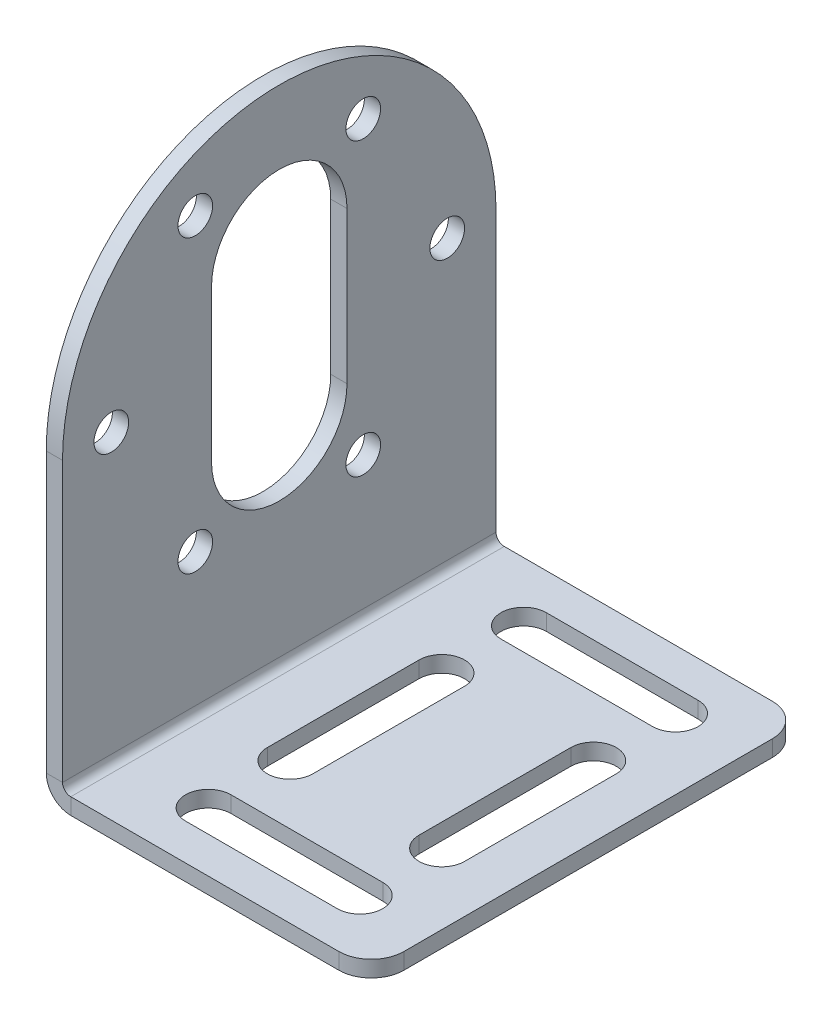
from build123d import *

# Parameters (mm, degrees)
BOSS_EXTRUDE1_DEPTH    = 1.5
SKETCH2_W              = 30
SKETCH2_H              = 40
BOSS_EXTRUDE2_DEPTH    = 1.5
CONVERT_SOLID1_START   = -20
CONVERT_SOLID1_DEPTH   = 40
CONVERT_SOLID1_2_DEPTH = 40
M3_CLEARANCE_HOLE1_D   = 3.2
CIRPATTERN1_COUNT      = 6
CUT_EXTRUDE1_DEPTH     = 46.650848842
FILLET1_R              = 3
CUT_EXTRUDE2_DEPTH     = 1.5


# Read off the part's stored shape, not the designer's step: Convert-Solid1
with BuildPart() as part:
    # Sketch1 → Boss-Extrude1 (new body)
    with BuildSketch(Plane(origin=(0, 0, 0), x_dir=(0, 0, -1), z_dir=(1, 0, 0))):
        with BuildLine():
            Line((-20, 0), (-20, -28))
            Line((-20, -28), (20, -28))
            Line((20, -28), (20, 0))
            ThreePointArc((20, 0), (0, 20), (-20, 0))
        make_face()
    extrude(amount=BOSS_EXTRUDE1_DEPTH)

    # Sketch2 → Boss-Extrude2 (add)
    with BuildSketch(Plane.XZ.offset(28)):
        with Locations((15, 0)):
            Rectangle(SKETCH2_W, SKETCH2_H)
    extrude(amount=-BOSS_EXTRUDE2_DEPTH)

    # Convert-Solid1 outline → Convert-Solid1 (cut)
    with BuildSketch(Plane.XY.offset(CONVERT_SOLID1_START)):
        with BuildLine():
            Line((0, -28), (2.262, -28))
            ThreePointArc((2.262, -28), (0.662524461, -27.337475539), (0, -25.738))
            Line((0, -25.738), (0, -28))
        make_face()
    extrude(amount=CONVERT_SOLID1_DEPTH, mode=Mode.SUBTRACT)

    # Convert-Solid1 2 outline → Convert-Solid1 2 (add)
    with BuildSketch(Plane.XY.offset(CONVERT_SOLID1_START)):
        with BuildLine():
            Line((1.5, -26.5), (2.262, -26.5))
            ThreePointArc((2.262, -26.5), (1.723184633, -26.276815367), (1.5, -25.738))
            Line((1.5, -25.738), (1.5, -26.5))
        make_face()
    extrude(amount=CONVERT_SOLID1_2_DEPTH)

    # M3 Clearance Hole1 (through all)
    with Locations(Plane.ZY):
        with Locations((-15.5, 0)):
            m3_clearance_hole1 = Hole(M3_CLEARANCE_HOLE1_D / 2)

    # CirPattern1: M3 Clearance Hole1 ×6 about axis
    cirpattern1_axis = Axis((0, 0, 0), (1, 0, 0))
    for i in range(1, CIRPATTERN1_COUNT):
        add(m3_clearance_hole1.rotate(cirpattern1_axis, i * 360 / CIRPATTERN1_COUNT), mode=Mode.SUBTRACT)

    # Sketch9 → Cut-Extrude1 (cut, through all)
    with BuildSketch(Plane.ZY):
        with BuildLine():
            Line((6.25, 7), (6.25, -7))
            ThreePointArc((6.25, -7), (0, -13.25), (-6.25, -7))
            Line((-6.25, -7), (-6.25, 7))
            ThreePointArc((-6.25, 7), (0, 13.25), (6.25, 7))
        make_face()
    extrude(amount=-CUT_EXTRUDE1_DEPTH, mode=Mode.SUBTRACT)

    # Fillet1
    fillet1_edges = [part.edges().sort_by_distance(p)[0] for p in [
        (30, -27.25, 20),
        (30, -27.25, -20),
    ]]
    fillet(fillet1_edges, radius=FILLET1_R)

    # Sketch10 → Cut-Extrude2 (cut)
    with BuildSketch(Plane(origin=(0, -28, 0), x_dir=(-1, 0, 0), z_dir=(0, -1, 0))):
        with BuildLine():
            Line((-9.5, -16.65), (-23.5, -16.65))
            ThreePointArc((-23.5, -16.65), (-25.6, -14.55), (-23.5, -12.45))
            Line((-23.5, -12.45), (-9.5, -12.45))
            ThreePointArc((-9.5, -12.45), (-7.4, -14.55), (-9.5, -16.65))
        make_face()
        with BuildLine():
            Line((-7.4, 7), (-7.4, -7))
            ThreePointArc((-7.4, -7), (-9.5, -9.1), (-11.6, -7))
            Line((-11.6, -7), (-11.6, 7))
            ThreePointArc((-11.6, 7), (-9.5, 9.1), (-7.4, 7))
        make_face()
        with BuildLine():
            Line((-21.4, 7), (-21.4, -7))
            ThreePointArc((-21.4, -7), (-23.5, -9.1), (-25.6, -7))
            Line((-25.6, -7), (-25.6, 7))
            ThreePointArc((-25.6, 7), (-23.5, 9.1), (-21.4, 7))
        make_face()
        with BuildLine():
            Line((-9.5, 16.65), (-23.5, 16.65))
            ThreePointArc((-23.5, 16.65), (-25.6, 14.55), (-23.5, 12.45))
            Line((-23.5, 12.45), (-9.5, 12.45))
            ThreePointArc((-9.5, 12.45), (-7.4, 14.55), (-9.5, 16.65))
        make_face()
    extrude(amount=-CUT_EXTRUDE2_DEPTH, mode=Mode.SUBTRACT)


solid = part.part
